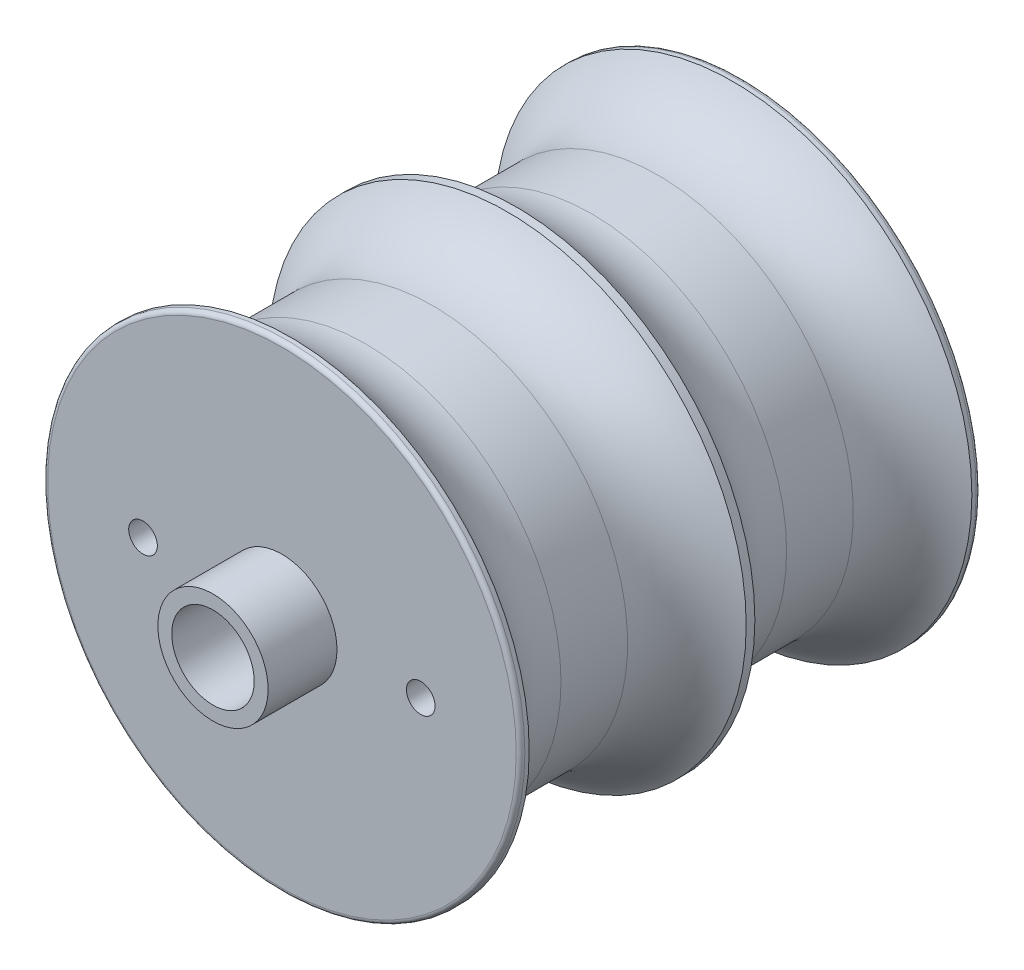
from build123d import *

# Parameters (mm, degrees)
SKETCH1_R           = 27.5
SKETCH1_R_2         = 22.5
SKETCH1_R_3         = 1.65
SKETCH1_R_4         = 4.75
SKETCH1_R_5         = 6.35
BOSS_EXTRUDE1_DEPTH = 1
BOSS_EXTRUDE2_START = 1
SKETCH1_3_R         = 22.5
SKETCH1_3_R_2       = 1.65
SKETCH1_3_R_3       = 4.75
SKETCH1_3_R_4       = 6.35
BOSS_EXTRUDE2_DEPTH = 25
BOSS_EXTRUDE3_START = 26
SKETCH1_4_R         = 27.5
SKETCH1_4_R_2       = 22.5
SKETCH1_4_R_3       = 1.65
SKETCH1_4_R_4       = 4.75
SKETCH1_4_R_5       = 6.35
BOSS_EXTRUDE3_DEPTH = 1
BOSS_EXTRUDE4_START = 27
SKETCH1_5_R         = 22.5
SKETCH1_5_R_2       = 1.65
SKETCH1_5_R_3       = 4.75
SKETCH1_5_R_4       = 6.35
BOSS_EXTRUDE4_DEPTH = 25
BOSS_EXTRUDE5_START = 52
SKETCH1_6_R         = 27.5
SKETCH1_6_R_2       = 22.5
SKETCH1_6_R_3       = 1.65
SKETCH1_6_R_4       = 4.75
SKETCH1_6_R_5       = 6.35
BOSS_EXTRUDE5_DEPTH = 1
FILLET1_R           = 10
FILLET2_R           = 0.5
BOSS_EXTRUDE6_START = 53
SKETCH1_7_R         = 6.35
SKETCH1_7_R_2       = 4.75
BOSS_EXTRUDE6_DEPTH = 7.938


with BuildPart() as part:
    # Sketch1 → Boss-Extrude1 (new body)
    # profile 1 of 3: a face of its own
    with BuildSketch(Plane.XY):
        Circle(SKETCH1_R)
        Circle(SKETCH1_R_2, mode=Mode.SUBTRACT)
    # profile 2 of 3: a face of its own
    with BuildSketch(Plane.XY):
        Circle(SKETCH1_R_2)
        with Locations((16, 0)):
            Circle(SKETCH1_R_3, mode=Mode.SUBTRACT)
        with Locations((-16, 0)):
            Circle(SKETCH1_R_3, mode=Mode.SUBTRACT)
        Circle(SKETCH1_R_4, mode=Mode.SUBTRACT)
    # profile 3 of 3: a face of its own
    with BuildSketch(Plane.XY):
        Circle(SKETCH1_R_5)
        Circle(SKETCH1_R_4, mode=Mode.SUBTRACT)
    extrude(amount=BOSS_EXTRUDE1_DEPTH)

    # Sketch1<3> → Boss-Extrude2 (add)
    # profile 1 of 2: a face of its own
    with BuildSketch(Plane.XY.offset(BOSS_EXTRUDE2_START)):
        Circle(SKETCH1_3_R)
        with Locations((16, 0)):
            Circle(SKETCH1_3_R_2, mode=Mode.SUBTRACT)
        with Locations((-16, 0)):
            Circle(SKETCH1_3_R_2, mode=Mode.SUBTRACT)
        Circle(SKETCH1_3_R_3, mode=Mode.SUBTRACT)
    # profile 2 of 2: a face of its own
    with BuildSketch(Plane.XY.offset(BOSS_EXTRUDE2_START)):
        Circle(SKETCH1_3_R_4)
        Circle(SKETCH1_3_R_3, mode=Mode.SUBTRACT)
    extrude(amount=BOSS_EXTRUDE2_DEPTH)

    # Sketch1<4> → Boss-Extrude3 (add)
    # profile 1 of 3: a face of its own
    with BuildSketch(Plane.XY.offset(BOSS_EXTRUDE3_START)):
        Circle(SKETCH1_4_R)
        Circle(SKETCH1_4_R_2, mode=Mode.SUBTRACT)
    # profile 2 of 3: a face of its own
    with BuildSketch(Plane.XY.offset(BOSS_EXTRUDE3_START)):
        Circle(SKETCH1_4_R_2)
        with Locations((16, 0)):
            Circle(SKETCH1_4_R_3, mode=Mode.SUBTRACT)
        with Locations((-16, 0)):
            Circle(SKETCH1_4_R_3, mode=Mode.SUBTRACT)
        Circle(SKETCH1_4_R_4, mode=Mode.SUBTRACT)
    # profile 3 of 3: a face of its own
    with BuildSketch(Plane.XY.offset(BOSS_EXTRUDE3_START)):
        Circle(SKETCH1_4_R_5)
        Circle(SKETCH1_4_R_4, mode=Mode.SUBTRACT)
    extrude(amount=BOSS_EXTRUDE3_DEPTH)

    # Sketch1<5> → Boss-Extrude4 (add)
    # profile 1 of 2: a face of its own
    with BuildSketch(Plane.XY.offset(BOSS_EXTRUDE4_START)):
        Circle(SKETCH1_5_R)
        with Locations((16, 0)):
            Circle(SKETCH1_5_R_2, mode=Mode.SUBTRACT)
        with Locations((-16, 0)):
            Circle(SKETCH1_5_R_2, mode=Mode.SUBTRACT)
        Circle(SKETCH1_5_R_3, mode=Mode.SUBTRACT)
    # profile 2 of 2: a face of its own
    with BuildSketch(Plane.XY.offset(BOSS_EXTRUDE4_START)):
        Circle(SKETCH1_5_R_4)
        Circle(SKETCH1_5_R_3, mode=Mode.SUBTRACT)
    extrude(amount=BOSS_EXTRUDE4_DEPTH)

    # Sketch1<6> → Boss-Extrude5 (add)
    # profile 1 of 3: a face of its own
    with BuildSketch(Plane.XY.offset(BOSS_EXTRUDE5_START)):
        Circle(SKETCH1_6_R)
        Circle(SKETCH1_6_R_2, mode=Mode.SUBTRACT)
    # profile 2 of 3: a face of its own
    with BuildSketch(Plane.XY.offset(BOSS_EXTRUDE5_START)):
        Circle(SKETCH1_6_R_2)
        with Locations((16, 0)):
            Circle(SKETCH1_6_R_3, mode=Mode.SUBTRACT)
        with Locations((-16, 0)):
            Circle(SKETCH1_6_R_3, mode=Mode.SUBTRACT)
        Circle(SKETCH1_6_R_4, mode=Mode.SUBTRACT)
    # profile 3 of 3: a face of its own
    with BuildSketch(Plane.XY.offset(BOSS_EXTRUDE5_START)):
        Circle(SKETCH1_6_R_5)
        Circle(SKETCH1_6_R_4, mode=Mode.SUBTRACT)
    extrude(amount=BOSS_EXTRUDE5_DEPTH)

    # Fillet1
    # the kernel refuses this fillet: 10 mm, written as the material it adds along each edge
    with BuildSketch(Plane(origin=(0, 0, 1), x_dir=(1, 0, 0), z_dir=(0, -1, 0))) as fillet1_piece_1:
        with BuildLine():
            CenterArc((32.5, 8.660254038), FILLET1_R, 180, 60)
            Line((22.5, 8.660254038), (22.3, 8.660254038))
            Line((22.3, 8.660254038), (22.3, 0))
            Line((22.3, 0), (22.5, -0.2))
            ThreePointArc((22.5, -0.2), (25, -0.2), (27.4, -0.173205081))
            Line((27.4, -0.173205081), (27.5, 0))
        make_face()
    revolve(axis=Axis((0, 0, 1), (0, 0, 1)))
    with BuildSketch(Plane(origin=(0, 0, 26), x_dir=(1, 0, 0), z_dir=(0, -1, 0))) as fillet1_piece_2:
        with BuildLine():
            CenterArc((32.5, -8.660254038), FILLET1_R, 120, 60)
            Line((27.5, 0), (27.4, 0.173205081))
            ThreePointArc((27.4, 0.173205081), (25, 0.2), (22.5, 0.2))
            Line((22.5, 0.2), (22.3, 0))
            Line((22.3, 0), (22.3, -8.660254038))
            Line((22.3, -8.660254038), (22.5, -8.660254038))
        make_face()
    revolve(axis=Axis((0, 0, 26), (0, 0, 1)))
    with BuildSketch(Plane(origin=(0, 0, 52), x_dir=(1, 0, 0), z_dir=(0, -1, 0))) as fillet1_piece_3:
        with BuildLine():
            CenterArc((32.5, -8.660254038), FILLET1_R, 120, 60)
            Line((27.5, 0), (27.4, 0.173205081))
            ThreePointArc((27.4, 0.173205081), (25, 0.2), (22.5, 0.2))
            Line((22.5, 0.2), (22.3, 0))
            Line((22.3, 0), (22.3, -8.660254038))
            Line((22.3, -8.660254038), (22.5, -8.660254038))
        make_face()
    revolve(axis=Axis((0, 0, 52), (0, 0, 1)))
    with BuildSketch(Plane(origin=(0, 0, 27), x_dir=(1, 0, 0), z_dir=(0, -1, 0))) as fillet1_piece_4:
        with BuildLine():
            CenterArc((32.5, 8.660254038), FILLET1_R, 180, 60)
            Line((22.5, 8.660254038), (22.3, 8.660254038))
            Line((22.3, 8.660254038), (22.3, 0))
            Line((22.3, 0), (22.5, -0.2))
            ThreePointArc((22.5, -0.2), (25, -0.2), (27.4, -0.173205081))
            Line((27.4, -0.173205081), (27.5, 0))
        make_face()
    revolve(axis=Axis((0, 0, 27), (0, 0, 1)))

    # Fillet2
    fillet2_edges = [part.edges().sort_by_distance(p)[0] for p in [
        (-27.5, 0, 53),
        (-27.5, 0, 0),
    ]]
    fillet(fillet2_edges, radius=FILLET2_R)


with BuildPart() as body_2:
    # Sketch1<7> → Boss-Extrude6 (new body)
    with BuildSketch(Plane.XY.offset(BOSS_EXTRUDE6_START)):
        Circle(SKETCH1_7_R)
        Circle(SKETCH1_7_R_2, mode=Mode.SUBTRACT)
    extrude(amount=BOSS_EXTRUDE6_DEPTH)


solid = Compound([part.part, body_2.part])
